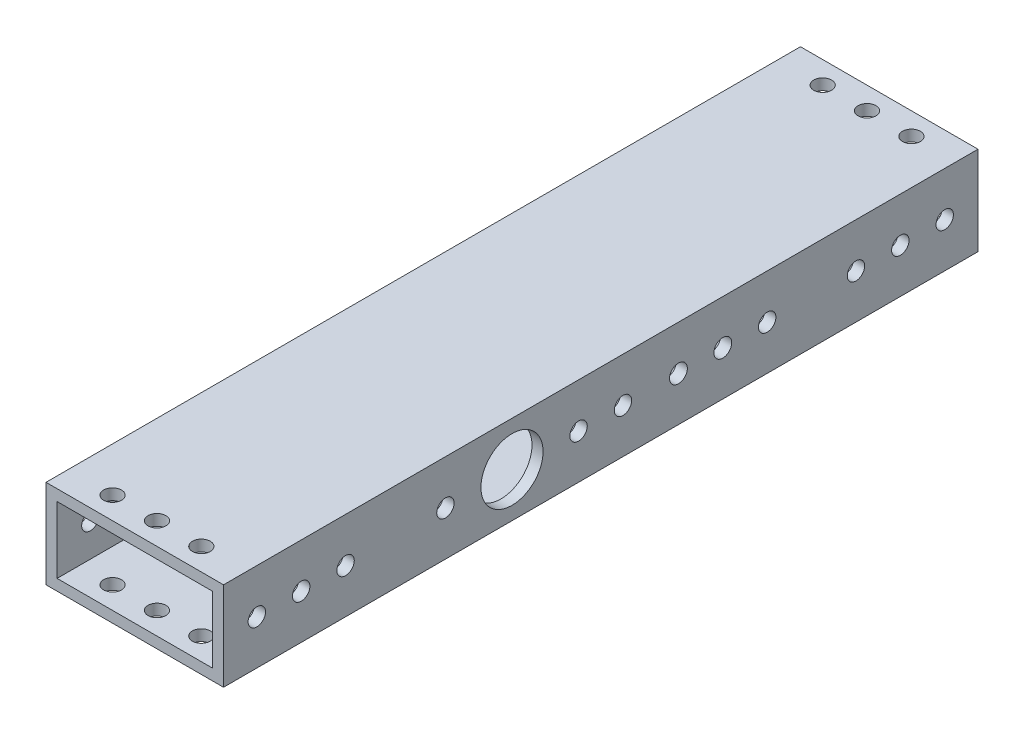
from build123d import *

# Parameters (mm, degrees)
SKETCH1_W           = 50.8
SKETCH1_H           = 25.4
SKETCH1_W_2         = 44.45
SKETCH1_H_2         = 19.05
BOSS_EXTRUDE1_DEPTH = 107.95
SKETCH3_R           = 2.5527
CUT_EXTRUDE2_DEPTH  = 114.769602707
SKETCH4_R           = 8.89
SKETCH4_R_2         = 2.5527
CUT_EXTRUDE3_DEPTH  = 120.979717036
SKETCH2_R           = 2.4892
CUT_EXTRUDE1_DEPTH  = 120.979717036
CUT_EXTRUDE4_REACH  = 115.77
SKETCH5_R           = 2.4892


with BuildPart() as part:
    # Sketch1 → Boss-Extrude1 (new, symmetric)
    with BuildSketch(Plane.XY):
        Rectangle(SKETCH1_W, SKETCH1_H)
        Rectangle(SKETCH1_W_2, SKETCH1_H_2, mode=Mode.SUBTRACT)
    extrude(amount=BOSS_EXTRUDE1_DEPTH, both=True)

    # Sketch3 → Cut-Extrude2 (cut, through all)
    with BuildSketch(Plane(origin=(0, 12.7, 0), x_dir=(1, 0, 0), z_dir=(0, 1, 0))):
        with Locations((-12.7, -101.6)):
            Circle(SKETCH3_R)
        with Locations((0, -101.6)):
            Circle(SKETCH3_R)
        with Locations((12.7, -101.6)):
            Circle(SKETCH3_R)
        with Locations((12.7, 101.6)):
            Circle(SKETCH3_R)
        with Locations((0, 101.6)):
            Circle(SKETCH3_R)
        with Locations((-12.7, 101.6)):
            Circle(SKETCH3_R)
    extrude(amount=-CUT_EXTRUDE2_DEPTH, mode=Mode.SUBTRACT)

    # Sketch4 → Cut-Extrude3 (cut, through all)
    with BuildSketch(Plane(origin=(25.4, 0, 0), x_dir=(0, 0, -1), z_dir=(1, 0, 0))):
        with Locations((-25.4, 0)):
            Circle(SKETCH4_R)
        with Locations((34.925, 0)):
            Circle(SKETCH4_R_2)
        with Locations((22.225, 0)):
            Circle(SKETCH4_R_2)
    extrude(amount=-CUT_EXTRUDE3_DEPTH, mode=Mode.SUBTRACT)

    # Sketch2 → Cut-Extrude1 (cut, through all)
    with BuildSketch(Plane(origin=(25.4, 0, 0), x_dir=(0, 0, -1), z_dir=(1, 0, 0))):
        with Locations((-98.425, 0)):
            Circle(SKETCH2_R)
        with Locations((98.425, 0)):
            Circle(SKETCH2_R)
        with Locations((-85.725, 0)):
            Circle(SKETCH2_R)
        with Locations((-73.025, 0)):
            Circle(SKETCH2_R)
        with Locations((73.025, 0)):
            Circle(SKETCH2_R)
        with Locations((85.725, 0)):
            Circle(SKETCH2_R)
        with Locations((-44.45, 0)):
            Circle(SKETCH2_R)
        with Locations((-6.35, 0)):
            Circle(SKETCH2_R)
        with Locations((6.35, 0)):
            Circle(SKETCH2_R)
        with Locations((47.625, 0)):
            Circle(SKETCH2_R)
    extrude(amount=-CUT_EXTRUDE1_DEPTH, mode=Mode.SUBTRACT)

    # Sketch5 → Cut-Extrude4 (cut, up to next)
    with BuildSketch(Plane.XZ.offset(12.7), mode=Mode.PRIVATE) as cut_extrude4_sk1:
        with Locations((-3.81, 69.85)):
            Circle(SKETCH5_R)
    cut_extrude4_tool1 = extrude(cut_extrude4_sk1.sketch, amount=-CUT_EXTRUDE4_REACH, mode=Mode.PRIVATE) & part.part
    # Sketch5 → Cut-Extrude4 (cut, up to next)
    with BuildSketch(Plane.XZ.offset(12.7), mode=Mode.PRIVATE) as cut_extrude4_sk2:
        with Locations((-16.51, 69.85)):
            Circle(SKETCH5_R)
    cut_extrude4_tool2 = extrude(cut_extrude4_sk2.sketch, amount=-CUT_EXTRUDE4_REACH, mode=Mode.PRIVATE) & part.part
    # Sketch5 → Cut-Extrude4 (cut, up to next)
    with BuildSketch(Plane.XZ.offset(12.7), mode=Mode.PRIVATE) as cut_extrude4_sk3:
        with Locations((-16.51, 57.15)):
            Circle(SKETCH5_R)
    cut_extrude4_tool3 = extrude(cut_extrude4_sk3.sketch, amount=-CUT_EXTRUDE4_REACH, mode=Mode.PRIVATE) & part.part
    # Sketch5 → Cut-Extrude4 (cut, up to next)
    with BuildSketch(Plane.XZ.offset(12.7), mode=Mode.PRIVATE) as cut_extrude4_sk4:
        with Locations((-3.81, 57.15)):
            Circle(SKETCH5_R)
    cut_extrude4_tool4 = extrude(cut_extrude4_sk4.sketch, amount=-CUT_EXTRUDE4_REACH, mode=Mode.PRIVATE) & part.part
    # Sketch5 → Cut-Extrude4 (cut, up to next)
    with BuildSketch(Plane.XZ.offset(12.7), mode=Mode.PRIVATE) as cut_extrude4_sk5:
        with Locations((-3.81, -6.35)):
            Circle(SKETCH5_R)
    cut_extrude4_tool5 = extrude(cut_extrude4_sk5.sketch, amount=-CUT_EXTRUDE4_REACH, mode=Mode.PRIVATE) & part.part
    # Sketch5 → Cut-Extrude4 (cut, up to next)
    with BuildSketch(Plane.XZ.offset(12.7), mode=Mode.PRIVATE) as cut_extrude4_sk6:
        with Locations((-16.51, -6.35)):
            Circle(SKETCH5_R)
    cut_extrude4_tool6 = extrude(cut_extrude4_sk6.sketch, amount=-CUT_EXTRUDE4_REACH, mode=Mode.PRIVATE) & part.part
    # Sketch5 → Cut-Extrude4 (cut, up to next)
    with BuildSketch(Plane.XZ.offset(12.7), mode=Mode.PRIVATE) as cut_extrude4_sk7:
        with Locations((-16.51, -19.05)):
            Circle(SKETCH5_R)
    cut_extrude4_tool7 = extrude(cut_extrude4_sk7.sketch, amount=-CUT_EXTRUDE4_REACH, mode=Mode.PRIVATE) & part.part
    # Sketch5 → Cut-Extrude4 (cut, up to next)
    with BuildSketch(Plane.XZ.offset(12.7), mode=Mode.PRIVATE) as cut_extrude4_sk8:
        with Locations((-3.81, -19.05)):
            Circle(SKETCH5_R)
    cut_extrude4_tool8 = extrude(cut_extrude4_sk8.sketch, amount=-CUT_EXTRUDE4_REACH, mode=Mode.PRIVATE) & part.part
    add(cut_extrude4_tool1.solids().sort_by_distance((-3.81, -12.7, 69.85))[0], mode=Mode.SUBTRACT)
    add(cut_extrude4_tool2.solids().sort_by_distance((-16.51, -12.7, 69.85))[0], mode=Mode.SUBTRACT)
    add(cut_extrude4_tool3.solids().sort_by_distance((-16.51, -12.7, 57.15))[0], mode=Mode.SUBTRACT)
    add(cut_extrude4_tool4.solids().sort_by_distance((-3.81, -12.7, 57.15))[0], mode=Mode.SUBTRACT)
    add(cut_extrude4_tool5.solids().sort_by_distance((-3.81, -12.7, -6.35))[0], mode=Mode.SUBTRACT)
    add(cut_extrude4_tool6.solids().sort_by_distance((-16.51, -12.7, -6.35))[0], mode=Mode.SUBTRACT)
    add(cut_extrude4_tool7.solids().sort_by_distance((-16.51, -12.7, -19.05))[0], mode=Mode.SUBTRACT)
    add(cut_extrude4_tool8.solids().sort_by_distance((-3.81, -12.7, -19.05))[0], mode=Mode.SUBTRACT)


solid = part.part
